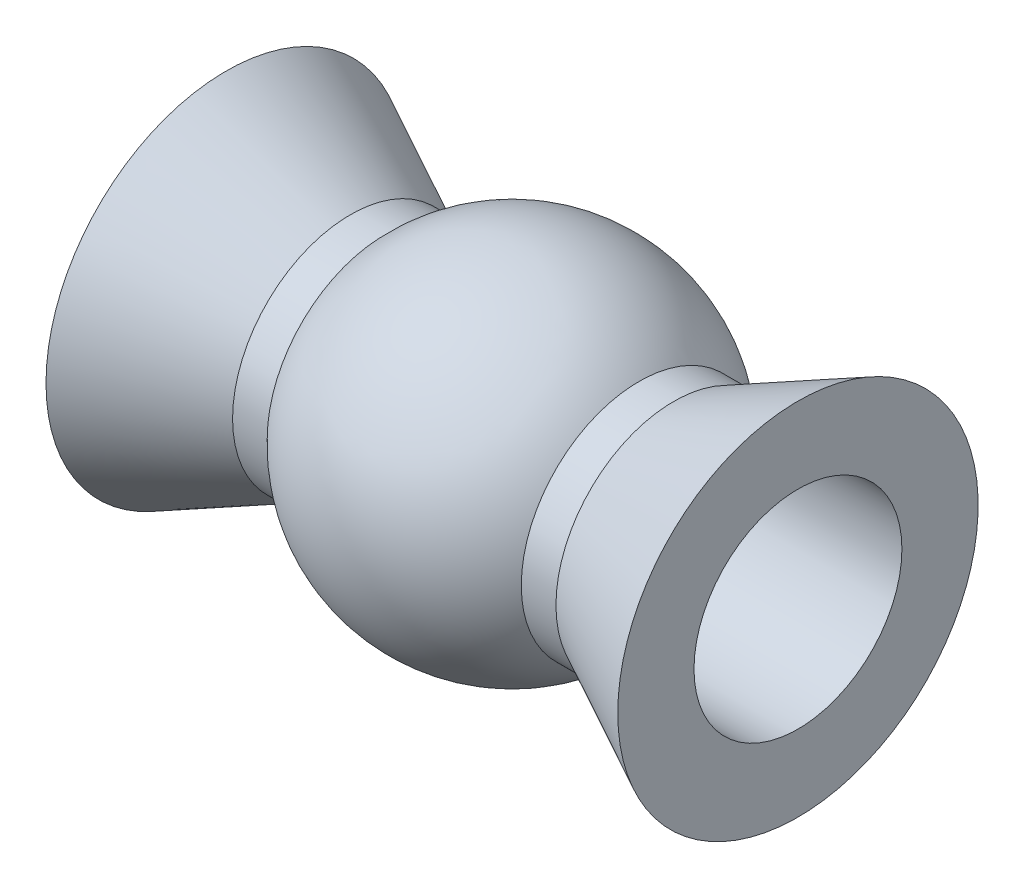
from build123d import *

# Parameters (mm, degrees)
SKETCH2_R          = 1.5
CUT_EXTRUDE1_DEPTH = 10.032303139


with BuildPart() as part:
    # Sketch1 → Revolve1 (revolve)
    with BuildSketch(Plane(origin=(0, 0, 0), x_dir=(1, 0, 0), z_dir=(0, 1, 0))):
        with BuildLine():
            Line((-4.125, 0), (4.125, 0))
            Line((4.125, 0), (4.125, 2.6))
            Line((4.125, 2.6), (2.333030278, 1.7))
            Line((2.333030278, 1.7), (1.833030278, 1.7))
            ThreePointArc((1.833030278, 1.7), (0, 2.5), (-1.833030278, 1.7))
            Line((-1.833030278, 1.7), (-2.333030278, 1.7))
            Line((-2.333030278, 1.7), (-4.125, 2.6))
            Line((-4.125, 2.6), (-4.125, 0))
        make_face()
    revolve(axis=Axis((-4.125, 0, 0), (1, 0, 0)))

    # Sketch2 → Cut-Extrude1 (cut, through all)
    with BuildSketch(Plane(origin=(4.125, 0, 0), x_dir=(0, 0, -1), z_dir=(1, 0, 0))):
        Circle(SKETCH2_R)
    extrude(amount=-CUT_EXTRUDE1_DEPTH, mode=Mode.SUBTRACT)


solid = part.part
